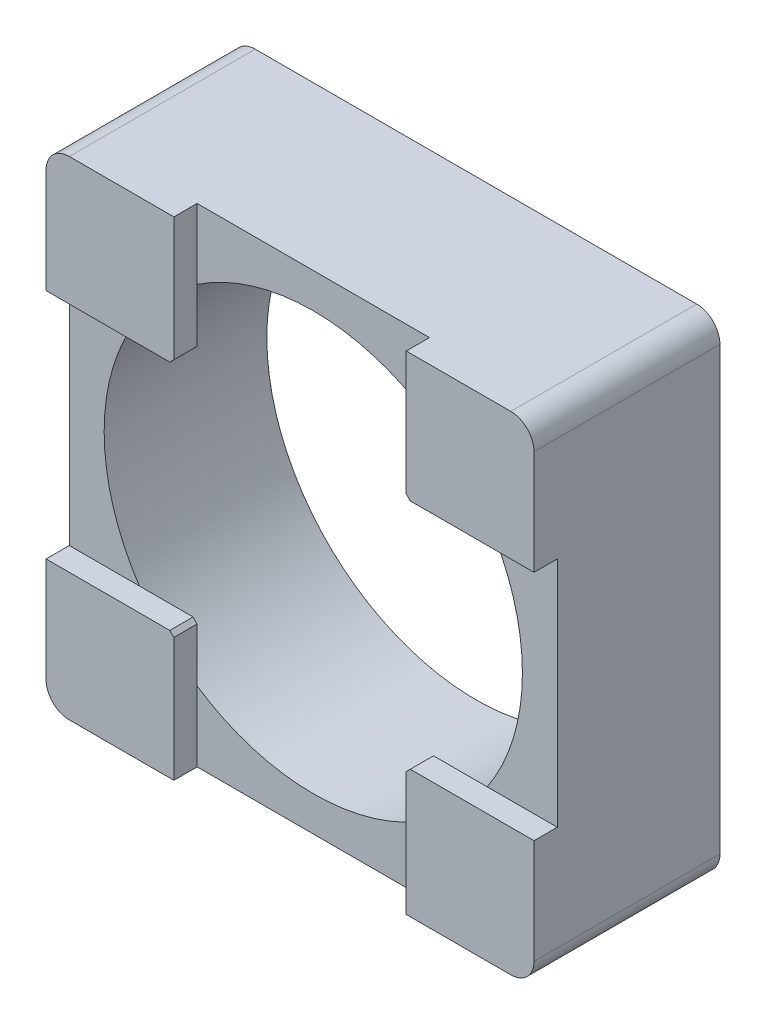
from build123d import *

# Parameters (mm, degrees)
SKETCH1_W           = 21
SKETCH1_H           = 21
SKETCH1_R           = 9
BOSS_EXTRUDE1_DEPTH = 4
BOSS_EXTRUDE2_START = -1
SKETCH2_R           = 9
SKETCH2_R_2         = 7.195345153
BOSS_EXTRUDE2_DEPTH = 1
CUT_EXTRUDE1_START  = -1
CUT_EXTRUDE1_DEPTH  = 1
FILLET1_R           = 1


with BuildPart() as part:
    # Sketch1 → Boss-Extrude1 (new, symmetric)
    with BuildSketch(Plane.XY):
        Rectangle(SKETCH1_W, SKETCH1_H)
        Circle(SKETCH1_R, mode=Mode.SUBTRACT)
    extrude(amount=BOSS_EXTRUDE1_DEPTH, both=True)

    # Sketch2 → Boss-Extrude2 (add)
    with BuildSketch(Plane.XY.offset(4).offset(BOSS_EXTRUDE2_START)):
        Circle(SKETCH2_R)
        Circle(SKETCH2_R_2, mode=Mode.SUBTRACT)
    extrude(amount=BOSS_EXTRUDE2_DEPTH)

    # Sketch3 → Cut-Extrude1 (cut)
    with BuildSketch(Plane.XY.offset(4).offset(CUT_EXTRUDE1_START)):
        with BuildLine():
            Line((-10.5, -5), (-5.174262446, -5))
            ThreePointArc((-5.174262446, -5), (-5.08787735, -5.08787735), (-5, -5.174262446))
            Line((-5, -5.174262446), (-5, -10.5))
            Line((-5, -10.5), (5, -10.5))
            Line((5, -10.5), (5, -5.174262446))
            ThreePointArc((5, -5.174262446), (5.08787735, -5.08787735), (5.174262446, -5))
            Line((5.174262446, -5), (10.5, -5))
            Line((10.5, -5), (10.5, 5))
            Line((10.5, 5), (5.174262446, 5))
            ThreePointArc((5.174262446, 5), (5.08787735, 5.08787735), (5, 5.174262446))
            Line((5, 5.174262446), (5, 10.5))
            Line((5, 10.5), (-5, 10.5))
            Line((-5, 10.5), (-5, 5.174262446))
            ThreePointArc((-5, 5.174262446), (-5.08787735, 5.08787735), (-5.174262446, 5))
            Line((-5.174262446, 5), (-10.5, 5))
            Line((-10.5, 5), (-10.5, -5))
        make_face()
    extrude(amount=CUT_EXTRUDE1_DEPTH, mode=Mode.SUBTRACT)

    # Fillet1
    fillet1_edges = [part.edges().sort_by_distance(p)[0] for p in [
        (-10.5, 10.5, 0),
        (-10.5, -10.5, 0),
        (10.5, 10.5, 0),
        (10.5, -10.5, 0),
    ]]
    fillet(fillet1_edges, radius=FILLET1_R)


solid = part.part
